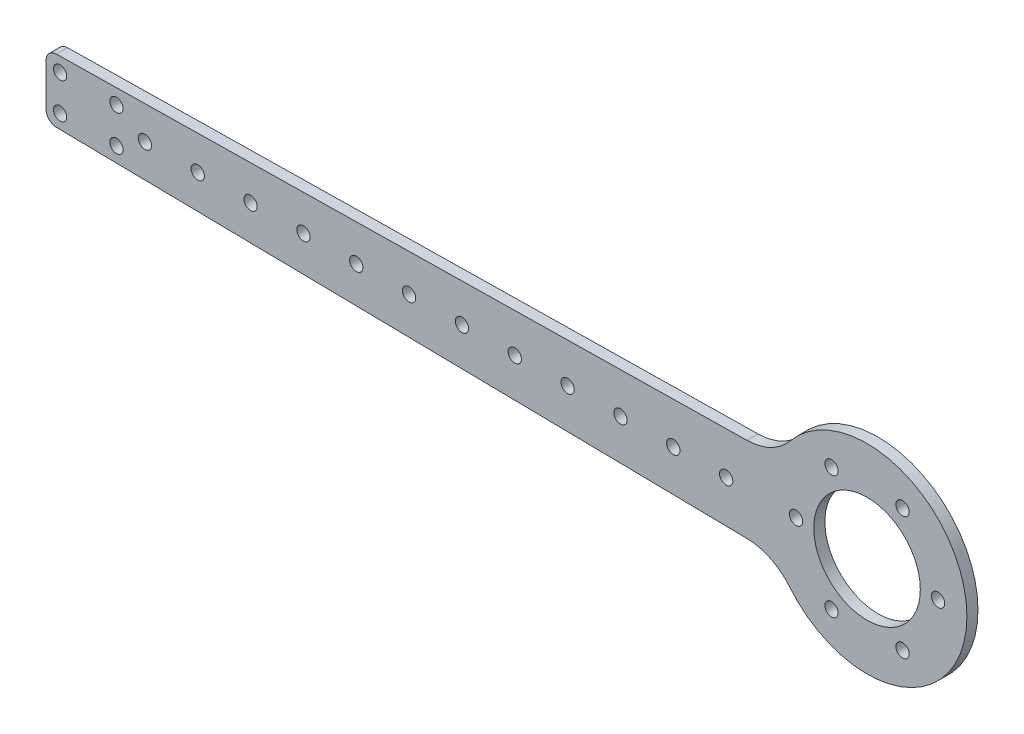
from build123d import *

# Parameters (mm, degrees)
BOSS_EXTRUDE1_DEPTH     = 1.25000004
FILLET1_R               = 12.7
BOSS_EXTRUDE2_DEPTH     = 1.25000004
CUT_EXTRUDE1_DEPTH      = 125.555459511
CUT_EXTRUDE1_DEPTH_BACK = 125.555459511
SKETCH3_R               = 12
SKETCH5_R               = 1.500000048
CUT_EXTRUDE2_DEPTH      = 125.555459511
CIRPATTERN1_COUNT       = 6
CUT_EXTRUDE3_DEPTH      = 125.57427501
CUT_EXTRUDE3_DEPTH_BACK = 125.57427501
SKETCH6_R               = 1.500000048
CUT_EXTRUDE4_DEPTH      = 125.555459511
CUT_EXTRUDE4_DEPTH_BACK = 125.555459511
SKETCH8_W               = 30
SKETCH8_H               = 50.8
FILLET2_R               = 2.38125
CUT_EXTRUDE5_DEPTH      = 125.57427501
CUT_EXTRUDE5_DEPTH_BACK = 125.57427501
SKETCH10_R              = 1.5


with BuildPart() as part:
    # Sketch1 → Boss-Extrude1 (new, symmetric)
    with BuildSketch(Plane.XY):
        with BuildLine():
            Line((-96.146161227, 6.939152165), (79.690718888, 9.684167378))
            ThreePointArc((79.690718888, 9.684167378), (122.499999983, 0), (79.690718888, -9.684167378))
            Line((79.690718888, -9.684167378), (-96.146161227, -6.939152165))
            ThreePointArc((-96.146161227, -6.939152165), (-107.937500025, 0), (-96.146161227, 6.939152165))
        make_face()
        with BuildLine():
            Line((-92.205520809, 1.5), (77.88703664, 4.155339753))
            ThreePointArc((77.88703664, 4.155339753), (77.500000067, 0), (77.88703664, -4.155339753))
            Line((77.88703664, -4.155339753), (-92.205520809, -1.5))
            Line((-92.205520809, -1.5), (-92.205520809, 1.5))
        make_face(mode=Mode.SUBTRACT)
    extrude(amount=BOSS_EXTRUDE1_DEPTH, both=True)

    # Fillet1
    fillet1_edges = [part.edges().sort_by_distance(p)[0] for p in [
        (79.690718888, 9.684167378, 0),
        (79.690718888, -9.684167378, 0),
        (-96.146161227, -6.939152165, 0),
        (-96.146161227, 6.939152165, 0),
    ]]
    fillet(fillet1_edges, radius=FILLET1_R)

    # Sketch2 → Boss-Extrude2 (add, symmetric)
    with BuildSketch(Plane.XY):
        with BuildLine():
            Line((-92.205520809, 1.5), (-92.205520809, -1.5))
            Line((-92.205520809, -1.5), (77.88703664, -4.155339753))
            ThreePointArc((77.88703664, -4.155339753), (77.500000067, 0), (77.88703664, 4.155339753))
            Line((77.88703664, 4.155339753), (-92.205520809, 1.5))
        make_face()
    extrude(amount=BOSS_EXTRUDE2_DEPTH, both=True)

    # Sketch3 → Cut-Extrude1 (cut, two sides: drawn at the far end of the back side and taken through both)
    with BuildSketch(Plane.XY.offset(-CUT_EXTRUDE1_DEPTH_BACK)):
        with Locations((100.000000025, 0)):
            Circle(SKETCH3_R)
    extrude(amount=CUT_EXTRUDE1_DEPTH + CUT_EXTRUDE1_DEPTH_BACK, mode=Mode.SUBTRACT)

    # Sketch5 → Cut-Extrude2 (cut, symmetric)
    with BuildSketch(Plane.XY):
        with Locations((116.000000029, 0)):
            Circle(SKETCH5_R)
    cut_extrude2 = extrude(amount=CUT_EXTRUDE2_DEPTH, both=True, mode=Mode.SUBTRACT)

    # CirPattern1: Cut-Extrude2 ×6 about axis
    cirpattern1_axis = Axis((100.000000025, 0, 1.25000004), (0, 0, -1))
    for i in range(1, CIRPATTERN1_COUNT):
        add(cut_extrude2.rotate(cirpattern1_axis, i * 360 / CIRPATTERN1_COUNT), mode=Mode.SUBTRACT)

    # Sketch6 → Cut-Extrude3 (cut, two sides: drawn at the far end of the back side and taken through both)
    with BuildSketch(Plane.XY.offset(1.25000004).offset(-CUT_EXTRUDE3_DEPTH_BACK)):
        with Locations((68.250000025, 0)):
            Circle(SKETCH6_R)
        with Locations((56.343750025, 0)):
            Circle(SKETCH6_R)
        with Locations((44.437500025, 0)):
            Circle(SKETCH6_R)
        with Locations((32.531250025, 0)):
            Circle(SKETCH6_R)
        with Locations((20.625000025, 0)):
            Circle(SKETCH6_R)
        with Locations((8.718750025, 0)):
            Circle(SKETCH6_R)
        with Locations((-3.187499975, 0)):
            Circle(SKETCH6_R)
        with Locations((-15.093749975, 0)):
            Circle(SKETCH6_R)
        with Locations((-26.999999975, 0)):
            Circle(SKETCH6_R)
        with Locations((-38.906249975, 0)):
            Circle(SKETCH6_R)
        with Locations((-50.812499975, 0)):
            Circle(SKETCH6_R)
        with Locations((-62.718749975, 0)):
            Circle(SKETCH6_R)
    extrude(amount=CUT_EXTRUDE3_DEPTH + CUT_EXTRUDE3_DEPTH_BACK, mode=Mode.SUBTRACT)

    # Sketch8 → Cut-Extrude4 (cut, two sides: drawn at the far end of the back side and taken through both)
    with BuildSketch(Plane.XY.offset(-CUT_EXTRUDE4_DEPTH_BACK)):
        with Locations((-100.000000025, 0)):
            Rectangle(SKETCH8_W, SKETCH8_H)
    extrude(amount=CUT_EXTRUDE4_DEPTH + CUT_EXTRUDE4_DEPTH_BACK, mode=Mode.SUBTRACT)

    # Fillet2
    fillet2_edges = [part.edges().sort_by_distance(p)[0] for p in [
        (-85.000000025, -7.113156515, 0),
        (-85.000000025, 7.113156515, 0),
    ]]
    fillet(fillet2_edges, radius=FILLET2_R)

    # Sketch10 → Cut-Extrude5 (cut, two sides: drawn at the far end of the back side and taken through both)
    with BuildSketch(Plane.XY.offset(1.25000004).offset(-CUT_EXTRUDE5_DEPTH_BACK)):
        with Locations((-81.825000025, 4)):
            Circle(SKETCH10_R)
        with Locations((-69.125000025, 4)):
            Circle(SKETCH10_R)
        with Locations((-69.125000025, -4)):
            Circle(SKETCH10_R)
        with Locations((-81.825000025, -4)):
            Circle(SKETCH10_R)
    extrude(amount=CUT_EXTRUDE5_DEPTH + CUT_EXTRUDE5_DEPTH_BACK, mode=Mode.SUBTRACT)


solid = part.part
